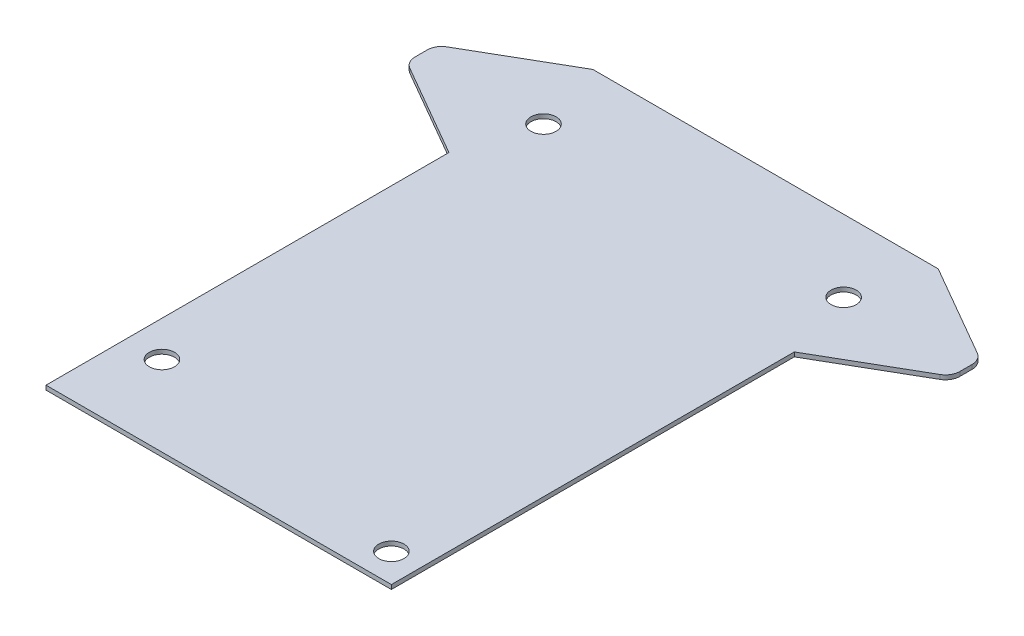
from build123d import *

# Parameters (mm, degrees)
BOSS_EXTRUDE2_DEPTH = 1.905
FILLET1_R           = 6.35
SKETCH4_R           = 5.55625
CUT_EXTRUDE1_DEPTH  = 2.54


with BuildPart() as part:
    # Sketch3 → Boss-Extrude2 (new body)
    with BuildSketch(Plane(origin=(0, 0, 0), x_dir=(1, 0, 0), z_dir=(0, 1, 0))):
        Polygon((165.1, 215.9), (12.7, 215.9), (-31.294090512, 190.5), (-31.294090512, 177.8), (12.7, 152.4), (12.7, -25.4), (165.1, -25.4), (165.1, 152.4), (209.094090512, 177.8), (209.094090512, 190.5), align=None)
    extrude(amount=BOSS_EXTRUDE2_DEPTH)

    # Fillet1
    fillet1_edges = [part.edges().sort_by_distance(p)[0] for p in [
        (209.094090512, 0.9525, -177.8),
        (209.094090512, 0.9525, -190.5),
        (-31.294090512, 0.9525, -190.5),
        (-31.294090512, 0.9525, -177.8),
    ]]
    fillet(fillet1_edges, radius=FILLET1_R)

    # Sketch4 → Cut-Extrude1 (cut)
    with BuildSketch(Plane(origin=(0, 1.905, 0), x_dir=(1, 0, 0), z_dir=(0, 1, 0))):
        with Locations((28.481410531, 9.970618753)):
            Circle(SKETCH4_R)
        with Locations((22.680909488, 184.15)):
            Circle(SKETCH4_R)
        with Locations((155.119090512, 184.15)):
            Circle(SKETCH4_R)
        with Locations((152.4, -12.7)):
            Circle(SKETCH4_R)
    extrude(amount=-CUT_EXTRUDE1_DEPTH, mode=Mode.SUBTRACT)


solid = part.part
